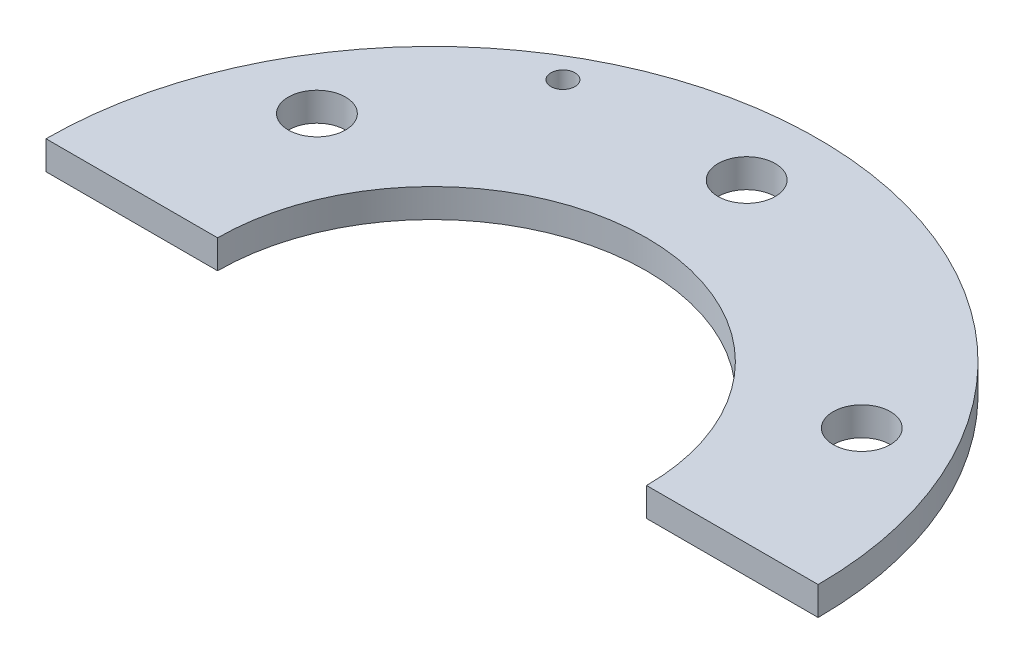
from build123d import *

# Parameters (mm, degrees)
SKETCH1_R               = 13.5
BOSS_EXTRUDE1_DEPTH     = 1
CUT_EXTRUDE1_DEPTH      = 20.118054294
CUT_EXTRUDE1_DEPTH_BACK = 20.118054294
SKETCH19_R              = 1
CUT_EXTRUDE2_DEPTH      = 20.118054294
CUT_EXTRUDE2_DEPTH_BACK = 20.118054294
SKETCH20_R              = 7.5
SKETCH21_W              = 65.874202484
SKETCH21_H              = 51.979273979
CUT_EXTRUDE3_DEPTH      = 20.118054294
CUT_EXTRUDE4_DEPTH      = 20.118054294
CUT_EXTRUDE4_DEPTH_BACK = 20.118054294
SKETCH22_R              = 0.42


with BuildPart() as part:
    # Sketch1 → Boss-Extrude1 (new body)
    with BuildSketch(Plane(origin=(0, 0, 0), x_dir=(1, 0, 0), z_dir=(0, 1, 0))):
        Circle(SKETCH1_R)
    extrude(amount=BOSS_EXTRUDE1_DEPTH)

    # Sketch19 → Cut-Extrude1 (cut, two sides: drawn at the far end of the back side and taken through both)
    with BuildSketch(Plane(origin=(0, 1, 0), x_dir=(1, 0, 0), z_dir=(0, 1, 0)).offset(-CUT_EXTRUDE1_DEPTH_BACK)):
        with Locations((0, 11)):
            Circle(SKETCH19_R)
        with Locations((9.526279442, 5.5)):
            Circle(SKETCH19_R)
        with Locations((9.526279442, -5.5)):
            Circle(SKETCH19_R)
        with Locations((0, -11)):
            Circle(SKETCH19_R)
        with Locations((-9.526279442, -5.5)):
            Circle(SKETCH19_R)
        with Locations((-9.526279442, 5.5)):
            Circle(SKETCH19_R)
    extrude(amount=CUT_EXTRUDE1_DEPTH + CUT_EXTRUDE1_DEPTH_BACK, mode=Mode.SUBTRACT)

    # Sketch20 → Cut-Extrude2 (cut, two sides: drawn at the far end of the back side and taken through both)
    with BuildSketch(Plane(origin=(0, 1, 0), x_dir=(1, 0, 0), z_dir=(0, 1, 0)).offset(-CUT_EXTRUDE2_DEPTH_BACK)):
        Circle(SKETCH20_R)
    extrude(amount=CUT_EXTRUDE2_DEPTH + CUT_EXTRUDE2_DEPTH_BACK, mode=Mode.SUBTRACT)

    # Sketch21 → Cut-Extrude3 (cut, through all)
    with BuildSketch(Plane.XY):
        with Locations((-3.816154381, 6.321647006)):
            Rectangle(SKETCH21_W, SKETCH21_H)
    extrude(amount=CUT_EXTRUDE3_DEPTH, mode=Mode.SUBTRACT)

    # Sketch22 → Cut-Extrude4 (cut, two sides: drawn at the far end of the back side and taken through both)
    with BuildSketch(Plane(origin=(0, 1, 0), x_dir=(1, 0, 0), z_dir=(0, 1, 0)).offset(-CUT_EXTRUDE4_DEPTH_BACK)):
        with Locations((-6.25, 10.825317547)):
            Circle(SKETCH22_R)
    extrude(amount=CUT_EXTRUDE4_DEPTH + CUT_EXTRUDE4_DEPTH_BACK, mode=Mode.SUBTRACT)


solid = part.part
